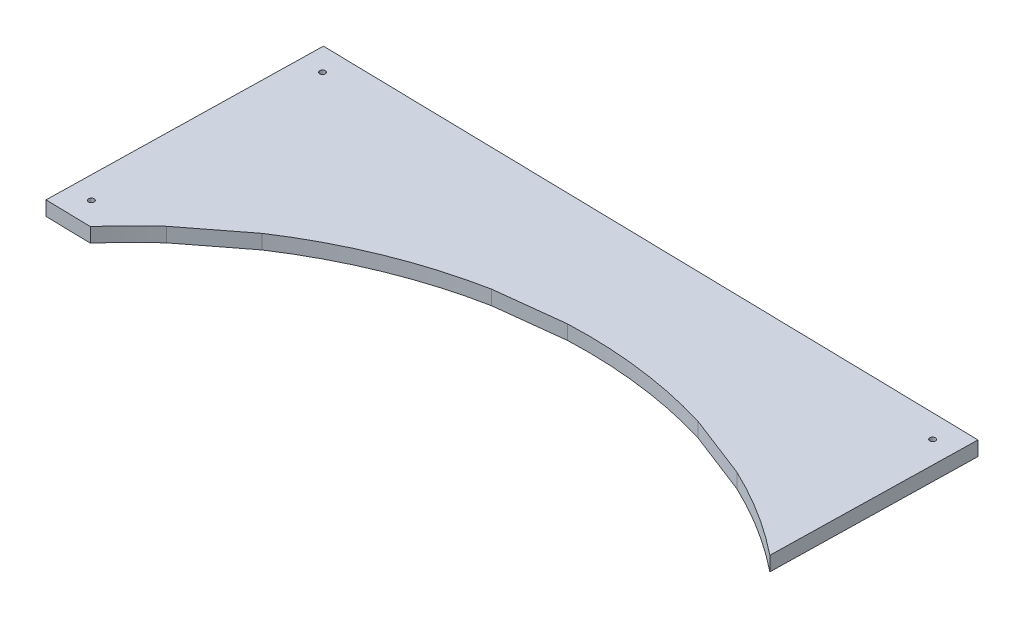
from build123d import *

# Parameters (mm, degrees)
SKETCH1_R           = 1.25
BOSS_EXTRUDE1_DEPTH = 6.35


with BuildPart() as part:
    # Sketch1 → Boss-Extrude1 (new body)
    with BuildSketch(Plane(origin=(0, 0, 0), x_dir=(1, 0, 0), z_dir=(0, 1, 0))):
        with BuildLine():
            Line((-12.884325045, 57.589892951), (-32.880086413, 58.0016299))
            Line((-32.880086413, 58.0016299), (-30.409664718, 177.976198108))
            Line((-30.409664718, 177.976198108), (264.52781546, 171.903078107))
            Line((264.52781546, 171.903078107), (262.674606435, 81.903078107))
            ThreePointArc((262.674606435, 81.903078107), (243.855743131, 95.27871358), (223.620762732, 106.396393581))
            Line((223.620762732, 106.396393581), (195.598020496, 117.247831174))
            ThreePointArc((195.598020496, 117.247831174), (162.959720984, 124.22900876), (129.614931972, 125.685195998))
            Line((129.614931972, 125.685195998), (99.614931972, 122.205605467))
            ThreePointArc((99.614931972, 122.205605467), (62.167456158, 111.077020968), (27.597724328, 92.881074194))
            Line((27.597724328, 92.881074194), (3.847059798, 74.546406222))
            ThreePointArc((3.847059798, 74.546406222), (-4.771312567, 66.317474746), (-12.884325045, 57.589892951))
        make_face()
        with Locations((-20.617652508, 167.77244895)):
            Circle(SKETCH1_R, mode=Mode.SUBTRACT)
        with Locations((-22.676337254, 67.79364211)):
            Circle(SKETCH1_R, mode=Mode.SUBTRACT)
        with Locations((254.324066301, 162.111065898)):
            Circle(SKETCH1_R, mode=Mode.SUBTRACT)
    extrude(amount=BOSS_EXTRUDE1_DEPTH)


solid = part.part
